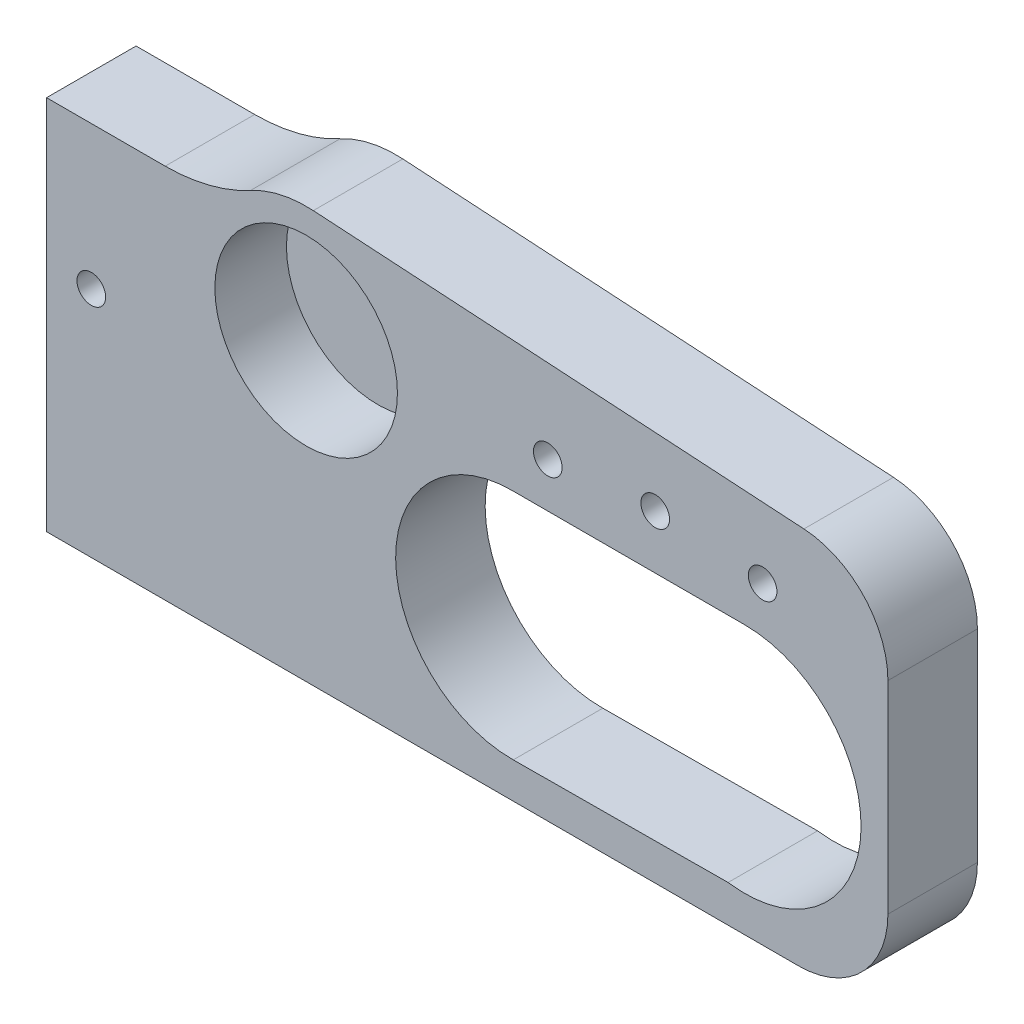
from build123d import *

# Parameters (mm, degrees)
SKETCH1_R           = 0.8
SKETCH1_R_2         = 5.1
BOSS_EXTRUDE1_DEPTH = 5
SKETCH2_R           = 1.25
CUT_EXTRUDE1_DEPTH  = 5
SKETCH21_R          = 5.1
BOSS_EXTRUDE2_DEPTH = 1


with BuildPart() as part:
    # Sketch1 → Boss-Extrude1 (new body)
    with BuildSketch(Plane(origin=(0, 0, 0), x_dir=(0, 1, 0), z_dir=(0, 0, 1))):
        with BuildLine():
            ThreePointArc((7.923715338, -23.061842121), (11.348253353, -21.704991773), (12.914157128, -18.370857874))
            Line((12.914157128, -18.370857874), (14.611258571, 9.036437401))
            ThreePointArc((14.611258571, 9.036437401), (14.470096631, 10.842810788), (13.835805455, 12.540039768))
            ThreePointArc((13.835805455, 12.540039768), (12.931450551, 14.850335933), (12.623684243, 17.312165753))
            Line((12.623684243, 17.312165753), (12.623684243, 23.938157879))
            Line((12.623684243, 23.938157879), (-8.376315757, 23.938157879))
            Line((-8.376315757, 23.938157879), (-8.376315757, -18.061842121))
            ThreePointArc((-8.376315757, -18.061842121), (-6.911849663, -21.597376027), (-3.376315757, -23.061842121))
            Line((-3.376315757, -23.061842121), (7.923715338, -23.061842121))
        make_face()
        with BuildLine():
            Line((-6.37591859, -2.133696229), (-6.376315757, -2.061842121))
            ThreePointArc((-6.376315757, -2.061842121), (0.123684243, 4.438157879), (6.623684243, -2.061842121))
            Line((6.623684243, -2.061842121), (6.623684243, -15.061842121))
            ThreePointArc((6.623684243, -15.061842121), (0.625179068, -21.542467318), (-6.298932046, -16.061842121))
            ThreePointArc((-6.298932046, -16.061842121), (-6.376216465, -15.097769724), (-6.309594086, -14.132901895))
            Line((-6.309594086, -14.132901895), (-6.37591859, -2.133696229))
        make_face(mode=Mode.SUBTRACT)
        with Locations((9.123684243, -16.061842121)):
            Circle(SKETCH1_R, mode=Mode.SUBTRACT)
        with Locations((9.623684243, -10.061842121)):
            Circle(SKETCH1_R, mode=Mode.SUBTRACT)
        with Locations((9.123684243, -4.061842121)):
            Circle(SKETCH1_R, mode=Mode.SUBTRACT)
        with Locations((8.123684243, 9.438157879)):
            Circle(SKETCH1_R_2, mode=Mode.SUBTRACT)
        with Locations((4.623684243, 21.438157879)):
            Circle(SKETCH1_R, mode=Mode.SUBTRACT)
    extrude(amount=BOSS_EXTRUDE1_DEPTH)

    # Sketch2 → Cut-Extrude1 (cut)
    with BuildSketch(Plane(origin=(-23.938157879, 0, 0), x_dir=(0, -1, 0), z_dir=(-1, 0, 0))):
        with Locations((-9.623684243, 2.5)):
            Circle(SKETCH2_R)
        with Locations((5.376315757, 2.5)):
            Circle(SKETCH2_R)
    extrude(amount=-CUT_EXTRUDE1_DEPTH, mode=Mode.SUBTRACT)

    # Sketch21 → Boss-Extrude2 (add)
    with BuildSketch(Plane(origin=(0, 0, 0), x_dir=(1, 0, 0), z_dir=(0, 0, -1))):
        with Locations((-9.438157879, -8.123684243)):
            Circle(SKETCH21_R)
    extrude(amount=-BOSS_EXTRUDE2_DEPTH)


solid = part.part
